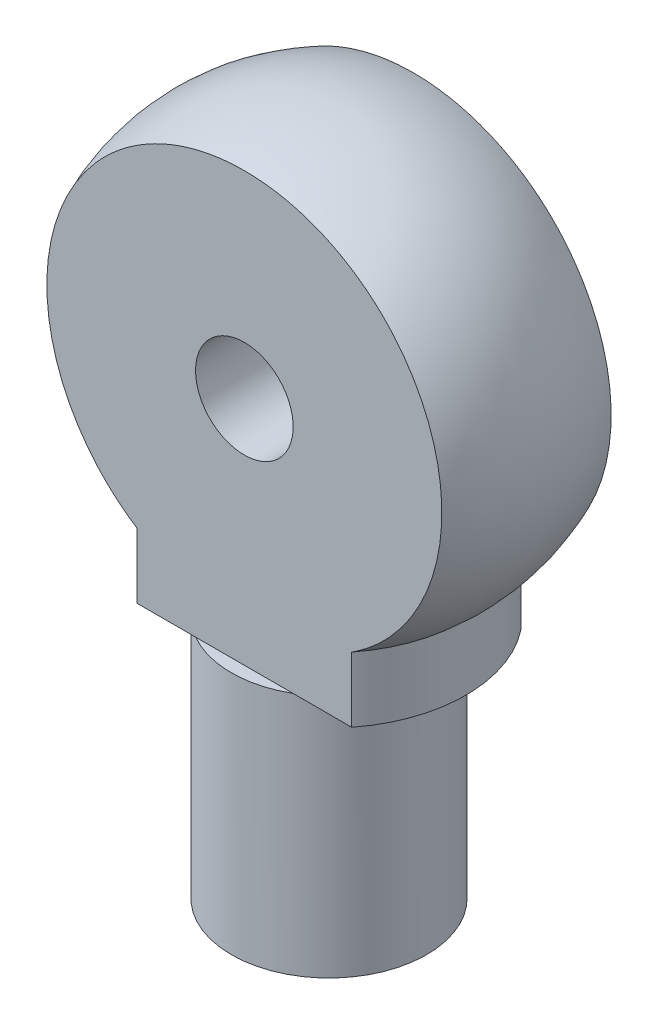
from build123d import *

# Parameters (mm, degrees)
SKETCH1_R               = 7.62
BOSS_EXTRUDE1_DEPTH     = 19.05
CUT_EXTRUDE1_DEPTH      = 59.815433775
CUT_EXTRUDE1_DEPTH_BACK = 59.815433775
SKETCH3_W               = 21.634870399
SKETCH3_H               = 44.538154166
SKETCH3_W_2             = 24.953070172
CUT_EXTRUDE2_DEPTH      = 59.142460648
CUT_EXTRUDE2_DEPTH_BACK = 59.142460648
SKETCH4_R               = 3.81


with BuildPart() as part:
    # Sketch1 → Boss-Extrude1 (new body)
    with BuildSketch(Plane(origin=(0, 0, 0), x_dir=(1, 0, 0), z_dir=(0, 1, 0))):
        Circle(SKETCH1_R)
    extrude(amount=BOSS_EXTRUDE1_DEPTH)

    # Sketch2 → Revolve1 (revolve)
    with BuildSketch(Plane(origin=(0, 0, 0), x_dir=(0, 0, -1), z_dir=(1, 0, 0))):
        with BuildLine():
            Line((-10.668, 19.05), (-10.668, 24.13))
            ThreePointArc((-10.668, 24.13), (-15.776826607, 42.729323061), (0, 53.825568814))
            Line((0, 53.825568814), (0, 19.05))
            Line((0, 19.05), (-10.668, 19.05))
        make_face()
    revolve(axis=Axis((0, 19.05, 0), (0, 1, 0)))

    # Sketch3 → Cut-Extrude1 (cut, two sides: drawn at the far end of the back side and taken through both)
    with BuildSketch(Plane(origin=(0, 0, 0), x_dir=(0, 0, -1), z_dir=(1, 0, 0)).offset(-CUT_EXTRUDE1_DEPTH_BACK)):
        with Locations((-17.4214352, 41.319077083)):
            Rectangle(SKETCH3_W, SKETCH3_H)
        with Locations((19.080535086, 41.319077083)):
            Rectangle(SKETCH3_W_2, SKETCH3_H)
    extrude(amount=CUT_EXTRUDE1_DEPTH + CUT_EXTRUDE1_DEPTH_BACK, mode=Mode.SUBTRACT)

    # Sketch4 → Cut-Extrude2 (cut, two sides: drawn at the far end of the back side and taken through both)
    with BuildSketch(Plane(origin=(0, 0, -6.604), x_dir=(-1, 0, 0), z_dir=(0, 0, -1)).offset(-CUT_EXTRUDE2_DEPTH_BACK)):
        with Locations((0, 37.061568814)):
            Circle(SKETCH4_R)
    extrude(amount=CUT_EXTRUDE2_DEPTH + CUT_EXTRUDE2_DEPTH_BACK, mode=Mode.SUBTRACT)


solid = part.part
